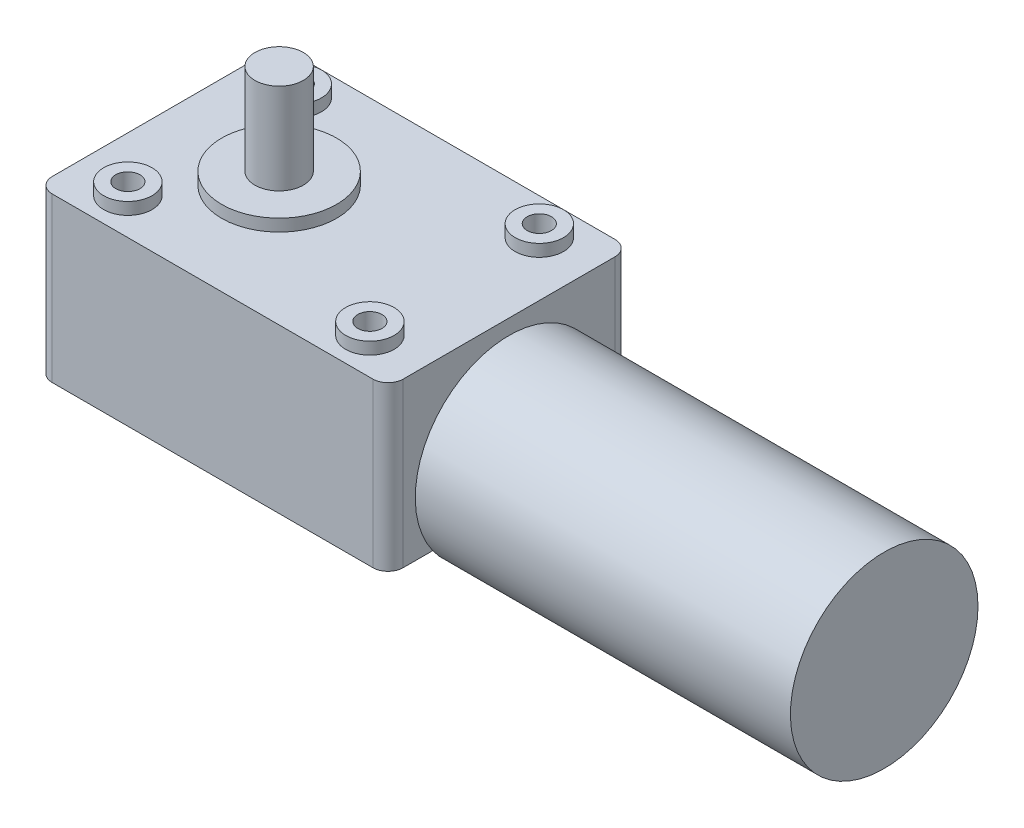
from build123d import *

# Parameters (mm, degrees)
BOSS_EXTRUDE1_DEPTH = 13.5
SKETCH2_R           = 4
SKETCH2_R_2         = 9.5
BOSS_EXTRUDE2_DEPTH = 2
SKETCH3_R           = 2
CUT_EXTRUDE1_DEPTH  = 6
SKETCH4_R           = 4
BOSS_EXTRUDE3_DEPTH = 15
SKETCH5_R           = 15.5
BOSS_EXTRUDE4_DEPTH = 62


with BuildPart() as part:
    # Sketch1 → Boss-Extrude1 (new, symmetric)
    with BuildSketch(Plane(origin=(0, 0, 0), x_dir=(1, 0, 0), z_dir=(0, 1, 0))):
        with BuildLine():
            Line((-26.5, -20), (26.5, -20))
            ThreePointArc((26.5, -20), (28.267766953, -19.267766953), (29, -17.5))
            Line((29, -17.5), (29, 17.5))
            ThreePointArc((29, 17.5), (28.267766953, 19.267766953), (26.5, 20))
            Line((26.5, 20), (-26.5, 20))
            ThreePointArc((-26.5, 20), (-28.267766953, 19.267766953), (-29, 17.5))
            Line((-29, 17.5), (-29, -17.5))
            ThreePointArc((-29, -17.5), (-28.267766953, -19.267766953), (-26.5, -20))
        make_face()
    extrude(amount=BOSS_EXTRUDE1_DEPTH, both=True)

    # Sketch2 → Boss-Extrude2 (add)
    with BuildSketch(Plane(origin=(0, 13.5, 0), x_dir=(1, 0, 0), z_dir=(0, 1, 0))):
        with Locations((-20, 14)):
            Circle(SKETCH2_R)
        with Locations((-20, -14)):
            Circle(SKETCH2_R)
        with Locations((20, -14)):
            Circle(SKETCH2_R)
        with Locations((20, 14)):
            Circle(SKETCH2_R)
        with Locations((-9, 0)):
            Circle(SKETCH2_R_2)
    extrude(amount=BOSS_EXTRUDE2_DEPTH)

    # Sketch3 → Cut-Extrude1 (cut)
    with BuildSketch(Plane(origin=(0, 15.5, 0), x_dir=(1, 0, 0), z_dir=(0, 1, 0))):
        with Locations((-20, 14)):
            Circle(SKETCH3_R)
        with Locations((20, 14)):
            Circle(SKETCH3_R)
        with Locations((20, -14)):
            Circle(SKETCH3_R)
        with Locations((-20, -14)):
            Circle(SKETCH3_R)
    extrude(amount=-CUT_EXTRUDE1_DEPTH, mode=Mode.SUBTRACT)

    # Sketch4 → Boss-Extrude3 (add)
    with BuildSketch(Plane(origin=(0, 15.5, 0), x_dir=(1, 0, 0), z_dir=(0, 1, 0))):
        with Locations((-9, 0)):
            Circle(SKETCH4_R)
    extrude(amount=BOSS_EXTRUDE3_DEPTH)

    # Sketch5 → Boss-Extrude4 (add)
    with BuildSketch(Plane(origin=(29, 0, 0), x_dir=(0, 0, -1), z_dir=(1, 0, 0))):
        with Locations((0, -4.5)):
            Circle(SKETCH5_R)
    extrude(amount=BOSS_EXTRUDE4_DEPTH)


solid = part.part
